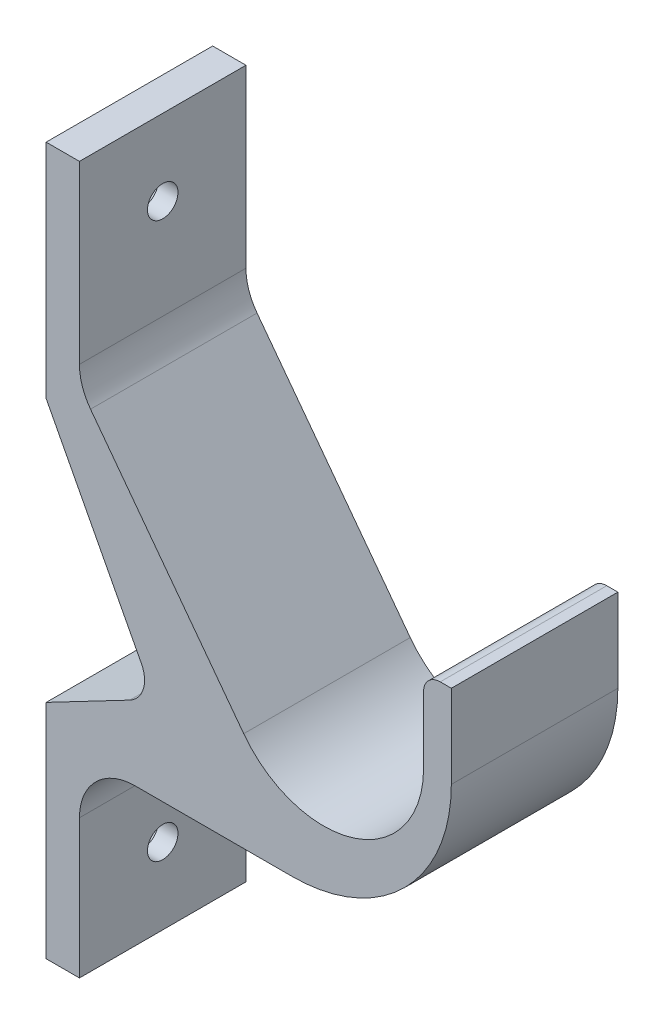
from build123d import *

# Parameters (mm, degrees)
BOSS_EXTRUDE1_DEPTH                             = 15
CSK_FOR_M5_FLAT_HEAD_MACHINE_SCREW1_D           = 5.5
CSK_FOR_M5_FLAT_HEAD_MACHINE_SCREW1_CSINK_D     = 10.4
CSK_FOR_M5_FLAT_HEAD_MACHINE_SCREW1_CSINK_ANGLE = 90


with BuildPart() as part:
    # Sketch1 → Boss-Extrude1 (new, symmetric)
    with BuildSketch(Plane.XY):
        with BuildLine():
            Line((0, -23.706539182), (0, -63.706539182))
            Line((0, -63.706539182), (6, -63.706539182))
            Line((6, -63.706539182), (6, -38.706539182))
            ThreePointArc((6, -38.706539182), (8.928932188, -31.63547137), (16, -28.706539182))
            Line((16, -28.706539182), (44.293460818, -28.706539182))
            ThreePointArc((44.293460818, -28.706539182), (64.592049338, -20.29858852), (73, 0))
            Line((73, 0), (73, 15))
            Line((73, 15), (71, 15))
            ThreePointArc((71, 15), (68.878679656, 14.121320344), (68, 12))
            Line((68, 12), (68, 0))
            ThreePointArc((68, 0), (55.687961475, -17.077678246), (35.594767305, -10.793019549))
            Line((35.594767305, -10.793019549), (7.997092947, 26.041058175))
            ThreePointArc((7.997092947, 26.041058175), (6.512400975, 28.87720155), (6, 32.037180147))
            Line((6, 32.037180147), (6, 63.706539182))
            Line((6, 63.706539182), (0, 63.706539182))
            Line((0, 63.706539182), (0, 23.706539182))
            Line((0, 23.706539182), (17.168258803, -9.069227623))
            ThreePointArc((17.168258803, -9.069227623), (17.511501017, -12.880637562), (15.0591361, -15.818420273))
            Line((15.0591361, -15.818420273), (0, -23.706539182))
        make_face()
    extrude(amount=BOSS_EXTRUDE1_DEPTH, both=True)

    # CSK for M5 Flat Head Machine Screw1 (through all)
    with Locations(Plane(origin=(0, 0, 0), x_dir=(0, 0, -1), z_dir=(-1, 0, 0))):
        with Locations((0, -50), (0, 50)):
            CounterSinkHole(CSK_FOR_M5_FLAT_HEAD_MACHINE_SCREW1_D / 2, CSK_FOR_M5_FLAT_HEAD_MACHINE_SCREW1_CSINK_D / 2, counter_sink_angle=CSK_FOR_M5_FLAT_HEAD_MACHINE_SCREW1_CSINK_ANGLE)


solid = part.part
